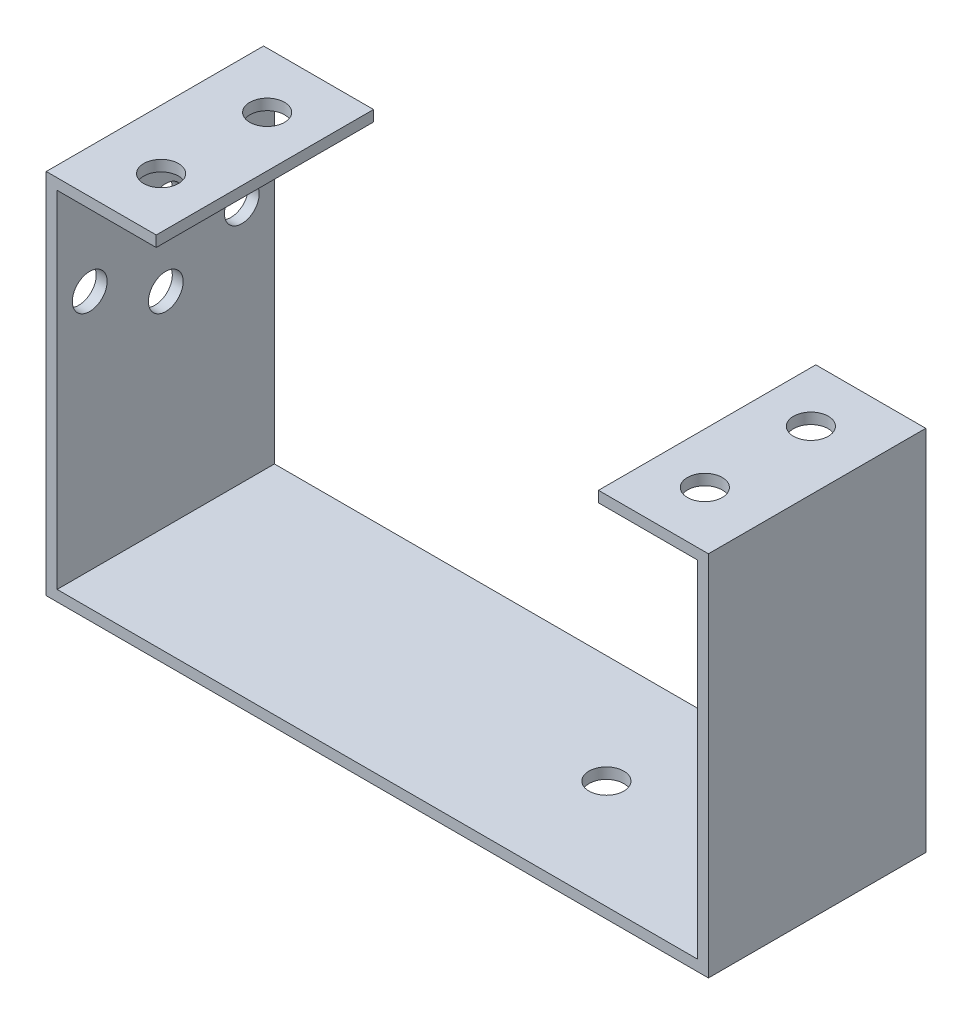
from build123d import *

# Parameters (mm, degrees)
SKETCH_2_W           = 60.94
SKETCH_2_H           = 20
EXTRUDE_1_DEPTH      = 1
SKETCH_3_W           = 1
SKETCH_3_H           = 20
EXTRUDE_2_DEPTH      = 32.81
SKETCH_4_W           = 1
SKETCH_4_H           = 20
EXTRUDE_3_DEPTH      = 32.81
SKETCH_9_W           = 20
SKETCH_9_H           = 1
EXTRUDE_8_DEPTH      = 9.12
SKETCH_10_W          = 20
SKETCH_10_H          = 1
EXTRUDE_9_DEPTH      = 9.12
SKETCH_13_R          = 1.6
CUT_EXTRUDE_2_DEPTH  = 1
SKETCH_14_R          = 1.6
CUT_EXTRUDE_3_DEPTH  = 1
SKETCH_15_R          = 1.6
CUT_EXTRUDE_4_DEPTH  = 1
SKETCH_16_R          = 1.6
CUT_EXTRUDE_5_DEPTH  = 1
SKETCH_17_R          = 1.6
CUT_EXTRUDE_6_DEPTH  = 1
SKETCH_19_R          = 1.6
CUT_EXTRUDE_7_DEPTH  = 1
SKETCH_20_R          = 1.6
CUT_EXTRUDE_8_DEPTH  = 1
SKETCH_22_R          = 1.6
CUT_EXTRUDE_9_DEPTH  = 1
SKETCH_23_R          = 1.6
CUT_EXTRUDE_10_DEPTH = 1


with BuildPart() as part:
    # ｽｹｯﾁ2 → ﾎﾞｽ - 押し出し1 (new body)
    with BuildSketch(Plane(origin=(0, 0, 0), x_dir=(1, 0, 0), z_dir=(0, 1, 0))):
        with Locations((30.47, 10)):
            Rectangle(SKETCH_2_W, SKETCH_2_H)
    extrude(amount=EXTRUDE_1_DEPTH)

    # ｽｹｯﾁ3 → ﾎﾞｽ - 押し出し2 (add)
    with BuildSketch(Plane(origin=(0, 1, 0), x_dir=(1, 0, 0), z_dir=(0, 1, 0))):
        with Locations((60.44, 10)):
            Rectangle(SKETCH_3_W, SKETCH_3_H)
    extrude(amount=EXTRUDE_2_DEPTH)

    # ｽｹｯﾁ4 → ﾎﾞｽ - 押し出し3 (add)
    with BuildSketch(Plane(origin=(0, 1, 0), x_dir=(1, 0, 0), z_dir=(0, 1, 0))):
        with Locations((0.5, 10)):
            Rectangle(SKETCH_4_W, SKETCH_4_H)
    extrude(amount=EXTRUDE_3_DEPTH)

    # ｽｹｯﾁ9 → ﾎﾞｽ - 押し出し8 (add)
    with BuildSketch(Plane.ZY.offset(-59.94)):
        with Locations((-10, 33.31)):
            Rectangle(SKETCH_9_W, SKETCH_9_H)
    extrude(amount=EXTRUDE_8_DEPTH)

    # ｽｹｯﾁ10 → ﾎﾞｽ - 押し出し9 (add)
    with BuildSketch(Plane(origin=(1, 0, 0), x_dir=(0, 0, -1), z_dir=(1, 0, 0))):
        with Locations((10, 33.31)):
            Rectangle(SKETCH_10_W, SKETCH_10_H)
    extrude(amount=EXTRUDE_9_DEPTH)

    # ｽｹｯﾁ13 → ｶｯﾄ - 押し出し2 (cut)
    with BuildSketch(Plane(origin=(0, 33.81, 0), x_dir=(1, 0, 0), z_dir=(0, 1, 0))):
        with Locations((55.49, 5.12)):
            Circle(SKETCH_13_R)
    extrude(amount=-CUT_EXTRUDE_2_DEPTH, mode=Mode.SUBTRACT)

    # ｽｹｯﾁ14 → ｶｯﾄ - 押し出し3 (cut)
    with BuildSketch(Plane(origin=(0, 33.81, 0), x_dir=(1, 0, 0), z_dir=(0, 1, 0))):
        with Locations((55.49, 14.88)):
            Circle(SKETCH_14_R)
    extrude(amount=-CUT_EXTRUDE_3_DEPTH, mode=Mode.SUBTRACT)

    # ｽｹｯﾁ15 → ｶｯﾄ - 押し出し4 (cut)
    with BuildSketch(Plane(origin=(0, 33.81, 0), x_dir=(1, 0, 0), z_dir=(0, 1, 0))):
        with Locations((5.45, 5.12)):
            Circle(SKETCH_15_R)
    extrude(amount=-CUT_EXTRUDE_4_DEPTH, mode=Mode.SUBTRACT)

    # ｽｹｯﾁ16 → ｶｯﾄ - 押し出し5 (cut)
    with BuildSketch(Plane(origin=(0, 33.81, 0), x_dir=(1, 0, 0), z_dir=(0, 1, 0))):
        with Locations((5.45, 14.88)):
            Circle(SKETCH_16_R)
    extrude(amount=-CUT_EXTRUDE_5_DEPTH, mode=Mode.SUBTRACT)

    # ｽｹｯﾁ17 → ｶｯﾄ - 押し出し6 (cut)
    with BuildSketch(Plane(origin=(0, 0, 0), x_dir=(-1, 0, 0), z_dir=(0, -1, 0))):
        with Locations((-41.55, 10)):
            Circle(SKETCH_17_R)
    extrude(amount=-CUT_EXTRUDE_6_DEPTH, mode=Mode.SUBTRACT)

    # ｽｹｯﾁ19 → ｶｯﾄ - 押し出し7 (cut)
    with BuildSketch(Plane.ZY):
        with Locations((-3, 23.25)):
            Circle(SKETCH_19_R)
    extrude(amount=-CUT_EXTRUDE_7_DEPTH, mode=Mode.SUBTRACT)

    # ｽｹｯﾁ20 → ｶｯﾄ - 押し出し8 (cut)
    with BuildSketch(Plane.ZY):
        with Locations((-17, 23.25)):
            Circle(SKETCH_20_R)
    extrude(amount=-CUT_EXTRUDE_8_DEPTH, mode=Mode.SUBTRACT)

    # ｽｹｯﾁ22 → ｶｯﾄ - 押し出し9 (cut)
    with BuildSketch(Plane.ZY):
        with Locations((-10, 19.75)):
            Circle(SKETCH_22_R)
    extrude(amount=-CUT_EXTRUDE_9_DEPTH, mode=Mode.SUBTRACT)

    # ｽｹｯﾁ23 → ｶｯﾄ - 押し出し10 (cut)
    with BuildSketch(Plane.ZY):
        with Locations((-10, 26.75)):
            Circle(SKETCH_23_R)
    extrude(amount=-CUT_EXTRUDE_10_DEPTH, mode=Mode.SUBTRACT)


solid = part.part
